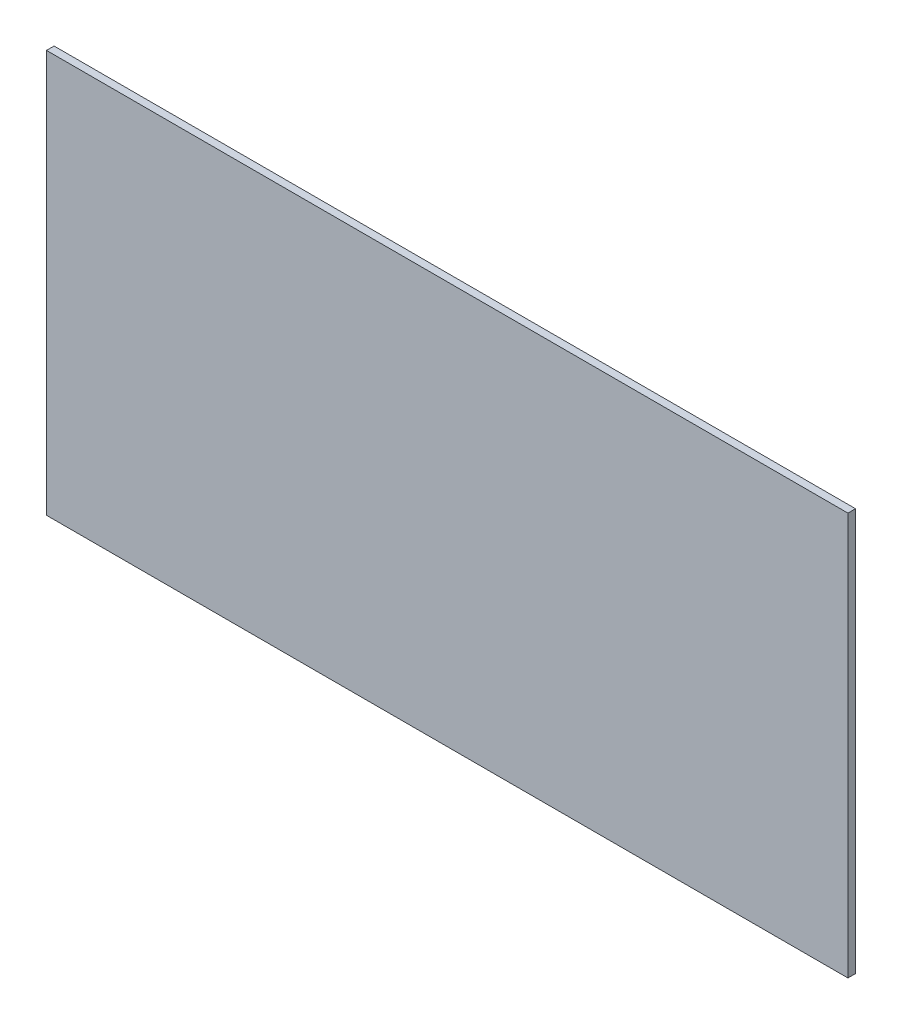
from build123d import *

# Parameters (mm, degrees)
SKETCH1_W           = 13.3985
SKETCH1_H           = 6.731
BOSS_EXTRUDE1_DEPTH = 0.127
WRAP1_DEPTH         = 0.0254


# Read off the part's stored shape, not the designer's step: Wrap1
with BuildPart() as part:
    # Sketch1 → Boss-Extrude1 (new body)
    with BuildSketch(Plane.XY):
        with Locations((8.078672263, -112.215755281)):
            Rectangle(SKETCH1_W, SKETCH1_H)
    extrude(amount=BOSS_EXTRUDE1_DEPTH)

    # Wrap1 outline → Wrap1 (cut)
    # profile 1 of 4: a face of its own
    with BuildSketch(Plane.XY):
        with BuildLine():
            add(Edge.make_bspline(
                [(4.150471592, -113.51896764), (4.140251183, -113.537921161), (4.120925659, -113.573759917), (4.076619277, -113.613355784), (4.023687419, -113.636342537), (3.986093317, -113.636248314), (3.966513149, -113.63619924)],
                knots=[0, 0, 0, 0, 0.27537767, 0.520704985, 0.750368369, 1, 1, 1, 1], degree=3))
            Line((4.150471592, -113.51896764), (5.157066296, -111.530298989))
            Line((5.157066296, -111.530298989), (5.157331452, -113.390697203))
            add(Edge.make_bspline(
                [(5.346127855, -113.63619924), (5.330260871, -113.636248177), (5.300584818, -113.636339705), (5.259595195, -113.625794752), (5.224920004, -113.609636167), (5.198015872, -113.583727904), (5.178073929, -113.549189082), (5.165724421, -113.504818629), (5.157691471, -113.451035394), (5.157457725, -113.411860316), (5.157331452, -113.390697203)],
                knots=[0, 0, 0, 0, 0.131102332, 0.245200967, 0.348332088, 0.444901594, 0.54994559, 0.675410014, 0.824650403, 1, 1, 1, 1], degree=3))
            add(Edge.make_bspline(
                [(5.535188111, -113.40745351), (5.534939208, -113.427029703), (5.534480935, -113.463072845), (5.526674268, -113.512794713), (5.513256249, -113.553744444), (5.492676989, -113.586094013), (5.465211856, -113.609888579), (5.431359544, -113.625962196), (5.390878899, -113.635299022), (5.361748583, -113.635885011), (5.346127855, -113.63619924)],
                knots=[0, 0, 0, 0, 0.169958689, 0.312923198, 0.435768891, 0.541897184, 0.641883299, 0.747323185, 0.864505568, 1, 1, 1, 1], degree=3))
            Line((5.535188111, -113.40745351), (5.535591383, -110.782238064))
            add(Edge.make_bspline(
                [(5.350797731, -110.567423782), (5.365095552, -110.567713049), (5.392319773, -110.568263838), (5.430385771, -110.578429678), (5.462865105, -110.595466358), (5.489673102, -110.619386207), (5.510112643, -110.650756165), (5.524398599, -110.688768023), (5.533892112, -110.733308203), (5.53500255, -110.765282843), (5.535591383, -110.782238064)],
                knots=[0, 0, 0, 0, 0.132047675, 0.251429568, 0.361053185, 0.468961391, 0.580331114, 0.704227458, 0.843160432, 1, 1, 1, 1], degree=3))
            add(Edge.make_bspline(
                [(5.17090002, -110.675357326), (5.181382901, -110.65879156), (5.201428962, -110.6271134), (5.243450166, -110.590312004), (5.295124596, -110.570166625), (5.33172488, -110.568363442), (5.350797731, -110.567423782)],
                knots=[0, 0, 0, 0, 0.264616796, 0.506017836, 0.742579929, 1, 1, 1, 1], degree=3))
            Line((5.17090002, -110.675357326), (4.168916559, -112.677965243))
            Line((4.168916559, -112.677965243), (4.169319179, -110.786907939))
            add(Edge.make_bspline(
                [(3.9758529, -110.567423782), (3.990805557, -110.567999216), (4.019091106, -110.56908775), (4.058896473, -110.578923684), (4.092559507, -110.596839896), (4.120663825, -110.621330548), (4.142561887, -110.653192383), (4.157612279, -110.692001251), (4.166753035, -110.737355448), (4.168430082, -110.76973939), (4.169319179, -110.786907939)],
                knots=[0, 0, 0, 0, 0.134289682, 0.254032258, 0.364905212, 0.473961644, 0.58596388, 0.708818882, 0.845628511, 1, 1, 1, 1], degree=3))
            add(Edge.make_bspline(
                [(3.790794743, -110.814749989), (3.791450137, -110.793896397), (3.792669538, -110.755097043), (3.798989453, -110.701531816), (3.812342614, -110.657703862), (3.830915597, -110.62239898), (3.857746916, -110.596477794), (3.891298176, -110.578929664), (3.931371154, -110.568009836), (3.960431793, -110.567626957), (3.9758529, -110.567423782)],
                knots=[0, 0, 0, 0, 0.174801586, 0.325228793, 0.450134547, 0.55688528, 0.655684646, 0.757374454, 0.871250096, 1, 1, 1, 1], degree=3))
            Line((3.790794743, -110.814749989), (3.791059248, -113.398702705))
            add(Edge.make_bspline(
                [(3.837090879, -113.584163482), (3.828160883, -113.575811781), (3.810493969, -113.559288955), (3.79824027, -113.529505733), (3.794720963, -113.501288704), (3.791856097, -113.473041145), (3.790798446, -113.438069464), (3.790967913, -113.412489253), (3.791059248, -113.398702705)],
                knots=[0, 0, 0, 0, 0.183207082, 0.362452968, 0.471352222, 0.613208043, 0.791537064, 1, 1, 1, 1], degree=3))
            add(Edge.make_bspline(
                [(3.966513149, -113.63619924), (3.953980871, -113.63587152), (3.929367768, -113.635227885), (3.894712, -113.624779075), (3.862946193, -113.608464964), (3.84586709, -113.592412267), (3.837090879, -113.584163482)],
                knots=[0, 0, 0, 0, 0.260922121, 0.512444992, 0.749466618, 1, 1, 1, 1], degree=3))
        make_face()
    # profile 2 of 4: a face of its own
    with BuildSketch(Plane.XY):
        with BuildLine():
            add(Edge.make_bspline(
                [(6.330804502, -113.384693077), (6.305042397, -113.349444577), (6.252537254, -113.277605434), (6.188172601, -113.156465173), (6.133355407, -113.023034926), (6.089377093, -112.876498111), (6.053810409, -112.717586218), (6.029083808, -112.545858262), (6.013530671, -112.361387441), (6.011587083, -112.234157507), (6.010584454, -112.168524021)],
                knots=[0, 0, 0, 0, 0.102218537, 0.208329207, 0.320506384, 0.439869332, 0.566442547, 0.701844883, 0.846192171, 1, 1, 1, 1], degree=3))
            add(Edge.make_bspline(
                [(6.909241704, -113.678894595), (6.883806761, -113.677521365), (6.832300317, -113.674740536), (6.754782732, -113.658656815), (6.676820107, -113.633140851), (6.599038904, -113.598464384), (6.523771014, -113.555487212), (6.453110852, -113.505538724), (6.387849789, -113.449101893), (6.349914706, -113.406270067), (6.330804502, -113.384693077)],
                knots=[0, 0, 0, 0, 0.114313593, 0.231488101, 0.354396382, 0.48231915, 0.613432772, 0.743168709, 0.870618491, 1, 1, 1, 1], degree=3))
            Line((6.909241704, -113.678894595), (6.909869088, -113.678895246))
            add(Edge.make_bspline(
                [(7.410880038, -113.465415215), (7.392709198, -113.481559067), (7.356533535, -113.513699273), (7.297443929, -113.555376269), (7.236005616, -113.592659244), (7.171394289, -113.622843924), (7.10595838, -113.647766193), (7.040171983, -113.664987512), (6.974964446, -113.676292557), (6.931484112, -113.678031019), (6.909869088, -113.678895246)],
                knots=[0, 0, 0, 0, 0.130875677, 0.260555615, 0.388989564, 0.517624575, 0.644262944, 0.765751474, 0.883549944, 1, 1, 1, 1], degree=3))
            add(Edge.make_bspline(
                [(7.798479721, -112.116488263), (7.798216976, -112.156518115), (7.797703025, -112.234819617), (7.793877372, -112.349854762), (7.786337701, -112.459949108), (7.776678627, -112.565241868), (7.763333331, -112.665616729), (7.746666515, -112.760833333), (7.727284255, -112.851178975), (7.705498376, -112.936783901), (7.680085145, -113.01784523), (7.651347923, -113.094344727), (7.620252384, -113.167102641), (7.584461308, -113.2348517), (7.546972582, -113.299476104), (7.504368096, -113.358584227), (7.459959835, -113.414600852), (7.427175588, -113.448543751), (7.410880038, -113.465415215)],
                knots=[0, 0, 0, 0, 0.083413307, 0.163162916, 0.239790112, 0.313333137, 0.383455053, 0.450723208, 0.514706389, 0.575958318, 0.634727082, 0.691618963, 0.746197416, 0.79946178, 0.851196508, 0.901723909, 0.951151449, 1, 1, 1, 1], degree=3))
            add(Edge.make_bspline(
                [(7.446904794, -110.817595694), (7.476100664, -110.853830231), (7.535602124, -110.927676562), (7.608589709, -111.053866234), (7.669184553, -111.193489159), (7.709004583, -111.319224233), (7.735339026, -111.426503616), (7.752460816, -111.512452916), (7.767440387, -111.602731036), (7.77819912, -111.697423935), (7.787754344, -111.796143533), (7.794551051, -111.899141685), (7.797513069, -112.006394511), (7.798153642, -112.07935048), (7.798479721, -112.116488263)],
                knots=[0, 0, 0, 0, 0.101436435, 0.206728416, 0.316913062, 0.433099217, 0.494072046, 0.557937225, 0.624319648, 0.693727134, 0.765875076, 0.840771696, 0.918945819, 1, 1, 1, 1], degree=3))
            add(Edge.make_bspline(
                [(6.91920884, -110.567423782), (6.942629178, -110.56834795), (6.989838121, -110.570210818), (7.06031096, -110.584766693), (7.13141584, -110.604994687), (7.201677028, -110.634576236), (7.26960388, -110.67103278), (7.334304747, -110.712882543), (7.393441663, -110.762131606), (7.428999948, -110.799020726), (7.446904794, -110.817595694)],
                knots=[0, 0, 0, 0, 0.117026589, 0.235893339, 0.358710427, 0.486342007, 0.616192598, 0.743887146, 0.871038185, 1, 1, 1, 1], degree=3))
            add(Edge.make_bspline(
                [(6.334807253, -110.852953324), (6.355574398, -110.83167695), (6.396535707, -110.789711233), (6.463910775, -110.733580387), (6.536203223, -110.68598415), (6.611211493, -110.644545976), (6.688171992, -110.610998553), (6.765685448, -110.587366323), (6.842452368, -110.570605117), (6.893772969, -110.568478026), (6.91920884, -110.567423782)],
                knots=[0, 0, 0, 0, 0.133558737, 0.263432488, 0.393148502, 0.521956684, 0.648192162, 0.769571529, 0.885793452, 1, 1, 1, 1], degree=3))
            add(Edge.make_bspline(
                [(6.010584454, -112.168524021), (6.011604108, -112.093558711), (6.013570067, -111.949020589), (6.028654479, -111.740472825), (6.054631843, -111.548475561), (6.084203316, -111.399135821), (6.112876804, -111.288453183), (6.137160108, -111.211943403), (6.163417636, -111.14005513), (6.193068491, -111.073218036), (6.224262312, -111.01085148), (6.258120335, -110.953387568), (6.295087389, -110.901023856), (6.321708301, -110.868806188), (6.334807253, -110.852953324)],
                knots=[0, 0, 0, 0, 0.16284409, 0.313974276, 0.453892687, 0.583497059, 0.644426551, 0.70217845, 0.757814594, 0.810592138, 0.86092999, 0.909230822, 0.955336575, 1, 1, 1, 1], degree=3))
        make_face()
        with BuildLine():
            add(Edge.make_bspline(
                [(7.419552665, -112.13049789), (7.419153108, -112.078001601), (7.418380488, -111.976489769), (7.409295301, -111.829623114), (7.396100068, -111.692983892), (7.375156202, -111.567242777), (7.349970089, -111.451650011), (7.316666179, -111.347370692), (7.279986446, -111.252549142), (7.248078308, -111.195767273), (7.232757637, -111.168503496)],
                knots=[0, 0, 0, 0, 0.158896388, 0.307257211, 0.445314327, 0.57424794, 0.692976378, 0.803053227, 0.905436137, 1, 1, 1, 1], degree=3))
            add(Edge.make_bspline(
                [(7.246767264, -113.050463403), (7.260621702, -113.02289615), (7.289211658, -112.966008493), (7.323456006, -112.873103551), (7.35249119, -112.771319576), (7.377368738, -112.66069163), (7.395361674, -112.540687287), (7.409682294, -112.412094933), (7.417244432, -112.274240393), (7.418766939, -112.179428029), (7.419552665, -112.13049789)],
                knots=[0, 0, 0, 0, 0.097908466, 0.202043468, 0.313782327, 0.433877003, 0.561812021, 0.698900242, 0.844610423, 1, 1, 1, 1], degree=3))
            add(Edge.make_bspline(
                [(6.909588512, -113.29994469), (6.924674699, -113.298979033), (6.955532682, -113.296976751), (7.00142418, -113.282740342), (7.047035753, -113.260296912), (7.091987523, -113.230073134), (7.135724612, -113.193965065), (7.175974247, -113.150869651), (7.214093169, -113.103507552), (7.235790271, -113.068283797), (7.246767264, -113.050463403)],
                knots=[0.00079286, 0.00079286, 0.00079286, 0.00079286, 0.104261604, 0.212462094, 0.327843685, 0.452318812, 0.583466916, 0.716274741, 0.856457777, 1, 1, 1, 1], degree=3))
            add(Edge.make_bspline(
                [(6.581643539, -113.092492284), (6.591997216, -113.106764752), (6.612615056, -113.135186294), (6.649559715, -113.173440773), (6.689938528, -113.208839696), (6.734173328, -113.239628551), (6.779187182, -113.265352493), (6.823799028, -113.284682969), (6.867173034, -113.296375131), (6.89583489, -113.298792654), (6.909588512, -113.29994469)],
                knots=[0, 0, 0, 0, 0.13180551, 0.26247147, 0.396949864, 0.533147162, 0.665047191, 0.784357365, 0.896166349, 0.999298693, 0.999298693, 0.999298693, 0.999298693], degree=3))
            add(Edge.make_bspline(
                [(6.389511511, -112.144507517), (6.390181256, -112.195444865), (6.3914839, -112.294517261), (6.400704218, -112.43882444), (6.416643044, -112.574433025), (6.438472501, -112.700701583), (6.46515821, -112.816570573), (6.497978055, -112.920455345), (6.534727934, -113.012611979), (6.566551562, -113.066796106), (6.581643539, -113.092492284)],
                knots=[0, 0, 0, 0, 0.15621051, 0.303827159, 0.443233162, 0.574749141, 0.696663336, 0.807526428, 0.908721697, 1, 1, 1, 1], degree=3))
            add(Edge.make_bspline(
                [(6.604992918, -111.135147241), (6.587855849, -111.160995422), (6.551839116, -111.215320174), (6.509164998, -111.30943353), (6.472979246, -111.417316974), (6.442506138, -111.53889767), (6.419097983, -111.673378354), (6.401721468, -111.81990167), (6.392142924, -111.97826695), (6.390409293, -112.087789746), (6.389511511, -112.144507517)],
                knots=[0, 0, 0, 0, 0.088780597, 0.186588909, 0.295034394, 0.414690577, 0.545475669, 0.686048239, 0.83741609, 1, 1, 1, 1], degree=3))
            add(Edge.make_bspline(
                [(6.905199213, -110.946350838), (6.891565371, -110.947231149), (6.864390542, -110.948985776), (6.824378275, -110.959864371), (6.785099542, -110.975006875), (6.746599509, -110.995879681), (6.709880257, -111.023126613), (6.673783284, -111.055338901), (6.638281291, -111.092828712), (6.6163347, -111.120728767), (6.604992918, -111.135147241)],
                knots=[0, 0, 0, 0, 0.111403148, 0.222047582, 0.33714062, 0.455068886, 0.578672945, 0.709987273, 0.850124266, 1, 1, 1, 1], degree=3))
            add(Edge.make_bspline(
                [(7.232757637, -111.168503496), (7.222698381, -111.152650673), (7.202739619, -111.121196781), (7.166188692, -111.079478622), (7.126718011, -111.041597498), (7.083688013, -111.009164729), (7.038752849, -110.982883044), (6.994107876, -110.962254461), (6.949448601, -110.949660102), (6.919724262, -110.947437118), (6.905199213, -110.946350838)],
                knots=[0, 0, 0, 0, 0.136847161, 0.271521084, 0.403547886, 0.535664444, 0.663710536, 0.782858226, 0.893891837, 1, 1, 1, 1], degree=3))
        make_face(mode=Mode.SUBTRACT)
    # profile 3 of 4: a face of its own
    with BuildSketch(Plane.XY):
        with BuildLine():
            add(Edge.make_bspline(
                [(8.316835924, -112.83298062), (8.318199471, -112.799131198), (8.32090427, -112.731985828), (8.33612791, -112.632954515), (8.362809343, -112.537514639), (8.397633258, -112.446241349), (8.440794075, -112.360905016), (8.491109816, -112.283761051), (8.54980236, -112.216610465), (8.59430682, -112.179112505), (8.616375093, -112.16051852)],
                knots=[0, 0, 0, 0, 0.133571488, 0.264958941, 0.394137348, 0.523815182, 0.649747928, 0.770668013, 0.886281932, 1, 1, 1, 1], degree=3))
            add(Edge.make_bspline(
                [(8.997234467, -113.624189685), (8.972728888, -113.622260263), (8.924464581, -113.61846022), (8.854195216, -113.603944941), (8.787325291, -113.58415128), (8.723931213, -113.557976606), (8.664496468, -113.525187089), (8.608731251, -113.486106805), (8.556504808, -113.441132768), (8.507879783, -113.390556783), (8.463950439, -113.33476303), (8.425861929, -113.274227279), (8.393055996, -113.210224553), (8.366250312, -113.142027257), (8.344893163, -113.070176945), (8.32990233, -112.994435173), (8.319349416, -112.915100735), (8.31768781, -112.860813209), (8.316835924, -112.83298062)],
                knots=[0, 0, 0, 0, 0.063599333, 0.125260361, 0.185380231, 0.243983491, 0.302487647, 0.360795932, 0.420007138, 0.480689722, 0.54220538, 0.603551003, 0.665616721, 0.728172033, 0.793035682, 0.859440249, 0.927936636, 1, 1, 1, 1], degree=3))
            Line((8.997234467, -113.624189685), (9.238322012, -113.636198589))
            Line((9.238322012, -113.636198589), (9.26215219, -113.63619924))
            add(Edge.make_bspline(
                [(9.847888027, -113.255270808), (9.831105139, -113.284481579), (9.798069212, -113.341980913), (9.735684286, -113.418047843), (9.666630618, -113.485063653), (9.590313156, -113.540644453), (9.509876848, -113.584522911), (9.428052702, -113.616677691), (9.345029743, -113.634899797), (9.289587065, -113.635769087), (9.26215219, -113.63619924)],
                knots=[0, 0, 0, 0, 0.137457703, 0.270575754, 0.400396349, 0.529806033, 0.655052246, 0.773856294, 0.888096596, 1, 1, 1, 1], degree=3))
            add(Edge.make_bspline(
                [(9.944621167, -112.916371258), (9.943099081, -112.941818245), (9.939818401, -112.996666267), (9.919257281, -113.080906459), (9.889564816, -113.169139003), (9.861858214, -113.226399164), (9.847888027, -113.255270808)],
                knots=[0, 0, 0, 0, 0.214938982, 0.463275972, 0.729373707, 1, 1, 1, 1], degree=3))
            add(Edge.make_bspline(
                [(9.760494639, -112.716900853), (9.774563781, -112.718250718), (9.801322776, -112.720818113), (9.838754608, -112.731174119), (9.870257684, -112.748537791), (9.896982616, -112.770530277), (9.917366515, -112.799241287), (9.932970238, -112.833047243), (9.941967412, -112.873017755), (9.943706534, -112.901429201), (9.944621167, -112.916371258)],
                knots=[0, 0, 0, 0, 0.138666773, 0.263739154, 0.37805668, 0.489608986, 0.600539826, 0.720713111, 0.853118334, 1, 1, 1, 1], degree=3))
            add(Edge.make_bspline(
                [(9.597716115, -112.80029149), (9.606337799, -112.787413733), (9.623258265, -112.762140518), (9.661804638, -112.73493878), (9.708681877, -112.719680349), (9.742584022, -112.717861668), (9.760494639, -112.716900853)],
                knots=[0, 0, 0, 0, 0.240289466, 0.471579558, 0.720833701, 1, 1, 1, 1], degree=3))
            add(Edge.make_bspline(
                [(9.569696861, -112.90236163), (9.572116607, -112.892792345), (9.576453792, -112.875640231), (9.582543556, -112.852982363), (9.586901728, -112.836210321), (9.591693817, -112.822710069), (9.593556559, -112.810944526), (9.596511181, -112.803377447), (9.597716115, -112.80029149)],
                knots=[0, 0, 0, 0, 0.279617859, 0.501190759, 0.664744974, 0.770350089, 0.906345655, 1, 1, 1, 1], degree=3))
            add(Edge.make_bspline(
                [(9.224140392, -113.259379752), (9.246733043, -113.258539113), (9.289727184, -113.256939367), (9.350096187, -113.239222694), (9.403424309, -113.212563817), (9.449403142, -113.173868067), (9.487918062, -113.1231715), (9.521153192, -113.060996076), (9.548918344, -112.986133034), (9.562485941, -112.931433431), (9.569696861, -112.90236163)],
                knots=[0, 0, 0, 0, 0.123786576, 0.23556764, 0.342676436, 0.449373233, 0.562541452, 0.690484287, 0.835498271, 1, 1, 1, 1], degree=3))
            Line((9.224140392, -113.259379752), (9.205231565, -113.259379752))
            Line((9.205231565, -113.259379752), (9.016650153, -113.255270808))
            add(Edge.make_bspline(
                [(8.831856501, -113.189892548), (8.843607821, -113.198143308), (8.86943464, -113.216276664), (8.915716684, -113.234064379), (8.965364936, -113.249274264), (8.999870797, -113.253308875), (9.016650153, -113.255270808)],
                knots=[0, 0, 0, 0, 0.216441272, 0.47569036, 0.745041044, 1, 1, 1, 1], degree=3))
            add(Edge.make_bspline(
                [(8.695095855, -112.828310744), (8.695975327, -112.847450044), (8.69768802, -112.884722129), (8.704067345, -112.939046114), (8.715361934, -112.989765676), (8.731013224, -113.036703136), (8.749315596, -113.080748066), (8.773192283, -113.120510269), (8.799416086, -113.158105099), (8.821048885, -113.17930247), (8.831856501, -113.189892548)],
                knots=[0, 0, 0, 0, 0.144669834, 0.281731651, 0.412517926, 0.536256951, 0.655113272, 0.771766142, 0.885975748, 1, 1, 1, 1], degree=3))
            add(Edge.make_bspline(
                [(8.789827619, -112.522100324), (8.775540916, -112.544159774), (8.746863726, -112.58843892), (8.716567716, -112.66302292), (8.699404292, -112.743922534), (8.696553211, -112.799765907), (8.695095855, -112.828310744)],
                knots=[0, 0, 0, 0, 0.241778697, 0.485313731, 0.736913526, 1, 1, 1, 1], degree=3))
            add(Edge.make_bspline(
                [(8.987780054, -112.410395959), (8.965367537, -112.416527984), (8.923333031, -112.428028551), (8.867639298, -112.453700388), (8.821152329, -112.4828461), (8.799914052, -112.509460619), (8.789827619, -112.522100324)],
                knots=[0, 0, 0, 0, 0.299891668, 0.56244457, 0.792197206, 1, 1, 1, 1], degree=3))
            Line((8.987780054, -112.410395959), (9.394910085, -112.308620292))
            add(Edge.make_bspline(
                [(10.018672053, -111.432017911), (10.017981903, -111.459397818), (10.016626201, -111.513181745), (10.007403024, -111.592233009), (9.994663336, -111.66818684), (9.975457185, -111.740710865), (9.952536619, -111.81032741), (9.923334077, -111.87652958), (9.890430273, -111.940089979), (9.85148438, -111.999535602), (9.808131839, -112.054615421), (9.761361234, -112.106052321), (9.709729097, -112.151699113), (9.654948666, -112.193823816), (9.595247004, -112.229419062), (9.532223597, -112.261044646), (9.4653014, -112.287968917), (9.418609727, -112.301667301), (9.394910085, -112.308620292)],
                knots=[0, 0, 0, 0, 0.070616639, 0.138716328, 0.205110655, 0.269112602, 0.332059551, 0.393976046, 0.455559475, 0.516498315, 0.576973694, 0.636245435, 0.695556026, 0.754527205, 0.814244199, 0.874531558, 0.936315042, 1, 1, 1, 1], degree=3))
            add(Edge.make_bspline(
                [(9.243049219, -110.567423782), (9.27125259, -110.568932183), (9.326446521, -110.571884121), (9.407100453, -110.5845881), (9.483374069, -110.604874582), (9.556090371, -110.631030516), (9.623445906, -110.666552099), (9.687568395, -110.70719307), (9.74718894, -110.755456832), (9.801703973, -110.811146985), (9.851415749, -110.872011649), (9.895463577, -110.937917598), (9.931715844, -111.008962578), (9.962970402, -111.084167651), (9.986809029, -111.164477694), (10.003824126, -111.249583147), (10.015613954, -111.339195011), (10.017637791, -111.400624817), (10.018672053, -111.432017911)],
                knots=[0, 0, 0, 0, 0.065201432, 0.127599052, 0.188140811, 0.247289808, 0.305632859, 0.363615379, 0.422408788, 0.482330892, 0.54329163, 0.60368726, 0.665018977, 0.727202757, 0.791546249, 0.858124041, 0.927495697, 1, 1, 1, 1], degree=3))
            Line((9.243049219, -110.567423782), (9.001973401, -110.563421031))
            add(Edge.make_bspline(
                [(8.256794665, -111.380649278), (8.257907186, -111.350600987), (8.260073158, -111.292099818), (8.27068249, -111.206551166), (8.288524947, -111.125799596), (8.310227545, -111.048642257), (8.341070951, -110.977210206), (8.37632456, -110.909618793), (8.418555313, -110.846909867), (8.466606107, -110.788815173), (8.519535571, -110.7364592), (8.576852687, -110.690390144), (8.638217895, -110.651736581), (8.703612973, -110.620141172), (8.772724221, -110.595344683), (8.845623363, -110.577585171), (8.922421867, -110.565648737), (8.975019551, -110.564175828), (9.001973401, -110.563421031)],
                knots=[0, 0, 0, 0, 0.072749061, 0.14163551, 0.208239069, 0.272775527, 0.335243706, 0.396150844, 0.457048471, 0.517822323, 0.57832872, 0.636908998, 0.695437342, 0.753443789, 0.812342086, 0.872774246, 0.934802758, 1, 1, 1, 1], degree=3))
            add(Edge.make_bspline(
                [(8.459600695, -111.645497943), (8.443923672, -111.644131919), (8.414197975, -111.641541758), (8.372649559, -111.627790271), (8.337024029, -111.606104915), (8.307800812, -111.575990755), (8.285405288, -111.537951472), (8.269910279, -111.492305772), (8.258909751, -111.439193443), (8.257528092, -111.400950054), (8.256794665, -111.380649278)],
                knots=[0, 0, 0, 0, 0.125243407, 0.237477963, 0.34582937, 0.455005964, 0.568828628, 0.695123677, 0.838162205, 1, 1, 1, 1], degree=3))
            add(Edge.make_bspline(
                [(8.635054596, -111.408668532), (8.634871888, -111.427151334), (8.634528603, -111.461877961), (8.626792331, -111.510577071), (8.612683029, -111.551698584), (8.594195862, -111.586435246), (8.568667294, -111.613411027), (8.537146265, -111.632570271), (8.499832447, -111.643157289), (8.473453787, -111.64469198), (8.459600695, -111.645497943)],
                knots=[0, 0, 0, 0, 0.164761429, 0.30956393, 0.437544781, 0.551227783, 0.657873367, 0.764703299, 0.876430919, 1, 1, 1, 1], degree=3))
            add(Edge.make_bspline(
                [(9.001961674, -110.935112647), (8.988853148, -110.93465359), (8.963269603, -110.933757661), (8.92548188, -110.935842816), (8.889791175, -110.944478817), (8.855216355, -110.956234161), (8.8225873, -110.97360762), (8.792426433, -110.996280834), (8.763203544, -111.022490345), (8.726886314, -111.064443616), (8.68901846, -111.126345104), (8.655549658, -111.210792123), (8.637298818, -111.306482849), (8.635822986, -111.373681579), (8.635054596, -111.408668532)],
                knots=[0, 0, 0, 0, 0.057893916, 0.112989943, 0.166318385, 0.219393398, 0.27382999, 0.328592895, 0.385562358, 0.446769483, 0.572846214, 0.703690997, 0.845727005, 1, 1, 1, 1], degree=3))
            Line((9.001961674, -110.935112647), (9.22946306, -110.935676837))
            add(Edge.make_bspline(
                [(9.479634972, -111.019067474), (9.464157095, -111.006020915), (9.432547683, -110.979376819), (9.372837806, -110.953741079), (9.304307869, -110.938411559), (9.255353176, -110.936622824), (9.22946306, -110.935676837)],
                knots=[0, 0, 0, 0, 0.223770634, 0.456991469, 0.712825212, 1, 1, 1, 1], degree=3))
            add(Edge.make_bspline(
                [(9.640412121, -111.432017911), (9.640004727, -111.411519795), (9.639203792, -111.371220702), (9.629695704, -111.31195091), (9.616778317, -111.254439138), (9.598039873, -111.199303032), (9.574919494, -111.147406656), (9.547437726, -111.099790079), (9.516198514, -111.056510364), (9.491741374, -111.031465032), (9.479634972, -111.019067474)],
                knots=[0, 0, 0, 0, 0.135094081, 0.26559362, 0.395124796, 0.523630082, 0.64905025, 0.769328651, 0.885816585, 1, 1, 1, 1], degree=3))
            add(Edge.make_bspline(
                [(9.493644599, -111.840298472), (9.504903797, -111.82790801), (9.527837019, -111.802670578), (9.555779121, -111.759001614), (9.581013557, -111.711579675), (9.602035847, -111.660175525), (9.618408417, -111.605334234), (9.631324902, -111.549029071), (9.638750804, -111.490921295), (9.639853354, -111.451829474), (9.640412121, -111.432017911)],
                knots=[0, 0, 0, 0, 0.112997851, 0.230158927, 0.349185819, 0.475927561, 0.60480001, 0.735733993, 0.866071147, 1, 1, 1, 1], degree=3))
            add(Edge.make_bspline(
                [(9.31395732, -111.932552622), (9.333580555, -111.927742673), (9.370654594, -111.91865527), (9.420248309, -111.896775744), (9.462249568, -111.872248036), (9.483570075, -111.850550943), (9.493644599, -111.840298472)],
                knots=[0, 0, 0, 0, 0.294796546, 0.556957043, 0.79065006, 1, 1, 1, 1], degree=3))
            Line((9.31395732, -111.932552622), (8.907908762, -112.035099001))
            add(Edge.make_bspline(
                [(8.616375093, -112.16051852), (8.635674684, -112.147399712), (8.674566589, -112.120963119), (8.740616902, -112.088020383), (8.818766152, -112.059290968), (8.876177591, -112.043710365), (8.907908762, -112.035099001)],
                knots=[0, 0, 0, 0, 0.219024644, 0.441371329, 0.691247208, 1, 1, 1, 1], degree=3))
        make_face()
    # profile 4 of 4: a face of its own
    with BuildSketch(Plane.XY):
        with BuildLine():
            add(Edge.make_bspline(
                [(11.988110041, -113.25727088), (12.007672146, -113.257178155), (12.044138563, -113.257005303), (12.094934961, -113.264622318), (12.137426519, -113.279481042), (12.172739943, -113.300074612), (12.199598882, -113.328381919), (12.218151808, -113.363118345), (12.228157038, -113.404376059), (12.228178816, -113.433784148), (12.228190383, -113.449404212)],
                knots=[0, 0, 0, 0, 0.164401574, 0.30646683, 0.429516722, 0.541147658, 0.646987278, 0.753272194, 0.868950875, 1, 1, 1, 1], degree=3))
            Line((11.988110041, -113.25727088), (10.87218956, -113.25727088))
            Line((10.87218956, -113.25727088), (10.87218956, -112.483407068))
            Line((10.87218956, -112.483407068), (11.679813551, -112.483407068))
            add(Edge.make_bspline(
                [(11.905301835, -112.291942164), (11.90505624, -112.307362319), (11.904594327, -112.336364476), (11.89416199, -112.376681065), (11.877770469, -112.411526771), (11.851753594, -112.438961212), (11.818726761, -112.459993509), (11.778618998, -112.474272546), (11.731574412, -112.483179463), (11.697872321, -112.483327659), (11.679813551, -112.483407068)],
                knots=[0, 0, 0, 0, 0.135054949, 0.25401074, 0.363244754, 0.469717383, 0.581371432, 0.704413742, 0.841614447, 1, 1, 1, 1], degree=3))
            add(Edge.make_bspline(
                [(11.665323125, -112.10447936), (11.684856015, -112.104652089), (11.721291783, -112.104974291), (11.771915226, -112.112652676), (11.814475326, -112.126662644), (11.849780027, -112.146590198), (11.876691018, -112.174205574), (11.895123055, -112.208108935), (11.905305156, -112.248217476), (11.905302988, -112.27676076), (11.905301835, -112.291942164)],
                knots=[0, 0, 0, 0, 0.166190244, 0.310003759, 0.433947569, 0.545980445, 0.651758679, 0.75768932, 0.871121468, 1, 1, 1, 1], degree=3))
            Line((11.665323125, -112.10447936), (10.87218956, -112.10447936))
            Line((10.87218956, -112.10447936), (10.87218956, -110.946350838))
            Line((10.87218956, -110.946350838), (12.00670485, -110.946350838))
            add(Edge.make_bspline(
                [(12.24220001, -110.754885935), (12.242185362, -110.770503651), (12.242157783, -110.799907319), (12.232191131, -110.841194433), (12.213579954, -110.875695567), (12.187491225, -110.904153792), (12.152759522, -110.925130572), (12.110520366, -110.938547413), (12.061059017, -110.94672609), (12.025642865, -110.946481583), (12.00670485, -110.946350838)],
                knots=[0, 0, 0, 0, 0.132714985, 0.249864141, 0.35750012, 0.463388537, 0.574824211, 0.698817694, 0.838949322, 1, 1, 1, 1], degree=3))
            add(Edge.make_bspline(
                [(11.988110041, -110.567423782), (12.008788545, -110.567586062), (12.047249165, -110.567887892), (12.100746914, -110.575649624), (12.145742098, -110.589507604), (12.183143876, -110.609290758), (12.211451736, -110.637065304), (12.231435193, -110.67077741), (12.242349769, -110.711087991), (12.242251939, -110.739699096), (12.24220001, -110.754885935)],
                knots=[0, 0, 0, 0, 0.17008837, 0.316352865, 0.443130698, 0.55620467, 0.661053016, 0.765276352, 0.875408155, 1, 1, 1, 1], degree=3))
            Line((11.988110041, -110.567423782), (10.729827409, -110.567423782))
            add(Edge.make_bspline(
                [(10.494067744, -110.818533839), (10.493485896, -110.796437776), (10.492415392, -110.755784635), (10.497230661, -110.699324343), (10.511563514, -110.653901903), (10.533898678, -110.617628913), (10.568040794, -110.592596805), (10.612469844, -110.576347102), (10.66766306, -110.567589172), (10.708003447, -110.567481845), (10.729827409, -110.567423782)],
                knots=[0, 0, 0, 0, 0.16005613, 0.294477095, 0.40801996, 0.502248162, 0.597570488, 0.70819914, 0.842137095, 1, 1, 1, 1], degree=3))
            Line((10.494067744, -110.818533839), (10.494332249, -113.390030078))
            add(Edge.make_bspline(
                [(10.73385231, -113.636198589), (10.712455255, -113.636179269), (10.67297142, -113.636143619), (10.618855324, -113.626928527), (10.574688911, -113.61156507), (10.539807642, -113.587230312), (10.516484496, -113.551572328), (10.50059031, -113.507145963), (10.493298087, -113.451851831), (10.493967531, -113.411832785), (10.494332249, -113.390030078)],
                knots=[0, 0, 0, 0, 0.156514694, 0.288815458, 0.400161158, 0.496932744, 0.594087477, 0.706959909, 0.840349341, 1, 1, 1, 1], degree=3))
            Line((10.73385231, -113.636198589), (12.002034974, -113.63619924))
            add(Edge.make_bspline(
                [(12.228190383, -113.449404212), (12.228146438, -113.464586293), (12.228063971, -113.493076752), (12.218526929, -113.532921316), (12.201952771, -113.567070951), (12.175736106, -113.593711259), (12.143102454, -113.614920518), (12.102333544, -113.628510644), (12.054617881, -113.636528335), (12.020306426, -113.636313594), (12.002034974, -113.63619924)],
                knots=[0, 0, 0, 0, 0.133385332, 0.250308863, 0.358107032, 0.463454922, 0.575429264, 0.698153607, 0.839261499, 1, 1, 1, 1], degree=3))
        make_face()
    extrude(amount=WRAP1_DEPTH, mode=Mode.SUBTRACT)


solid = part.part
